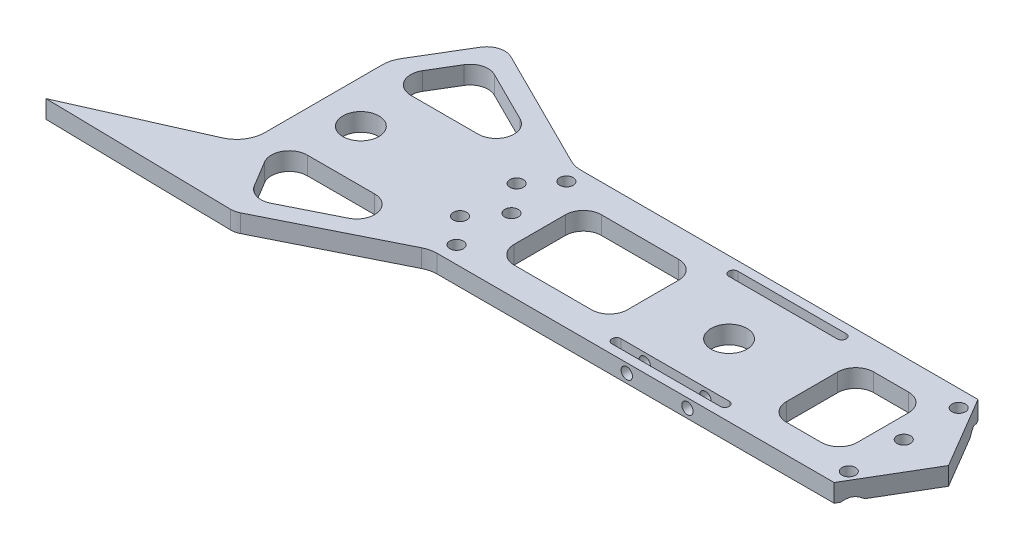
from build123d import *

# Parameters (mm, degrees)
CROQUIS1_R              = 6.35
SALIENTE_EXTRUIR1_DEPTH = 6.35
REDONDEO1_R             = 10
CORTAR_EXTRUIR2_DEPTH   = 225.405229946
CORTAR_EXTRUIR3_DEPTH   = 225.405229946
CROQUIS7_R              = 2.38125
CORTAR_EXTRUIR4_DEPTH   = 225.405229946
CROQUIS8_R              = 2.38125
CORTAR_EXTRUIR5_DEPTH   = 225.405229946
CROQUIS9_R              = 2
CORTAR_EXTRUIR6_DEPTH   = 15
CHAFL_N1_SIZE           = 2.5


with BuildPart() as part:
    # Croquis1 → Saliente-Extruir1 (new body)
    with BuildSketch(Plane(origin=(0, 0, 0), x_dir=(1, 0, 0), z_dir=(0, 1, 0))):
        with BuildLine():
            Line((37.5, -25.4), (52.5, 0))
            Line((52.5, 0), (37.5, 25.4))
            Line((37.5, 25.4), (-105, 25.4))
            Line((-105, 25.4), (-149.746813481, 47.731727951))
            ThreePointArc((-149.746813481, 47.731727951), (-154.357530471, 48.146831931), (-158.024774803, 45.321528145))
            Line((-158.024774803, 45.321528145), (-170, 25.4))
            Line((-170, 25.4), (-170, -25.4))
            Line((-170, -25.4), (-219.03156103, -47.147007635))
            Line((-219.03156103, -47.147007635), (-152.702210171, -48.398869348))
            ThreePointArc((-152.702210171, -48.398869348), (-151.184140049, -48.244143221), (-149.746813481, -47.731727951))
            Line((-149.746813481, -47.731727951), (-105, -25.4))
            Line((-105, -25.4), (37.5, -25.4))
        make_face()
        with Locations(Location((-155, 0, 0), (0, 0, 270))):
            Circle(CROQUIS1_R, mode=Mode.SUBTRACT)
        with Locations(Location((-25, 0, 0), (0, 0, 270))):
            Circle(CROQUIS1_R, mode=Mode.SUBTRACT)
        with BuildLine():
            Line((-129.045100716, 30.303281185), (-147.329198773, 39.428299747))
            ThreePointArc((-147.329198773, 39.428299747), (-151.939915763, 39.843403727), (-155.607160095, 37.018099941))
            Line((-155.607160095, 37.018099941), (-161.092389512, 27.893081378))
            ThreePointArc((-161.092389512, 27.893081378), (-161.177056347, 21.495189828), (-155.65, 18.271553233))
            Line((-155.65, 18.271553233), (-131.880672526, 18.271553233))
            ThreePointArc((-131.880672526, 18.271553233), (-125.699998109, 23.164925706), (-129.045100716, 30.303281185))
        make_face(mode=Mode.SUBTRACT)
        with BuildLine():
            Line((-129.045100716, -30.303281185), (-147.329198773, -39.428299747))
            ThreePointArc((-147.329198773, -39.428299747), (-151.939915763, -39.843403727), (-155.607160095, -37.018099941))
            Line((-155.607160095, -37.018099941), (-161.092389512, -27.893081378))
            ThreePointArc((-161.092389512, -27.893081378), (-161.177056347, -21.495189828), (-155.65, -18.271553233))
            Line((-155.65, -18.271553233), (-131.880672526, -18.271553233))
            ThreePointArc((-131.880672526, -18.271553233), (-125.699998109, -23.164925706), (-129.045100716, -30.303281185))
        make_face(mode=Mode.SUBTRACT)
    extrude(amount=SALIENTE_EXTRUIR1_DEPTH)

    # Redondeo1
    redondeo1_edges = [part.edges().sort_by_distance(p)[0] for p in [
        (-105, 3.175, 25.4),
        (-170, 3.175, 25.4),
        (-170, 3.175, -25.4),
        (-105, 3.175, -25.4),
    ]]
    fillet(redondeo1_edges, radius=REDONDEO1_R)

    # Croquis5 → Cortar-Extruir2 (cut, through all)
    with BuildSketch(Plane.XZ):
        with BuildLine():
            Line((-44.125, 22.225), (-5.875, 22.225))
            ThreePointArc((-5.875, 22.225), (-4.2875, 20.6375), (-5.875, 19.05))
            Line((-5.875, 19.05), (-44.125, 19.05))
            ThreePointArc((-44.125, 19.05), (-45.7125, 20.6375), (-44.125, 22.225))
        make_face()
        with BuildLine():
            Line((-5.875, -19.05), (-44.125, -19.05))
            ThreePointArc((-44.125, -19.05), (-45.7125, -20.6375), (-44.125, -22.225))
            Line((-44.125, -22.225), (-5.875, -22.225))
            ThreePointArc((-5.875, -22.225), (-4.2875, -20.6375), (-5.875, -19.05))
        make_face()
    extrude(amount=-CORTAR_EXTRUIR2_DEPTH, mode=Mode.SUBTRACT)

    # Croquis6 → Cortar-Extruir3 (cut, through all)
    with BuildSketch(Plane.XZ):
        with BuildLine():
            Line((-85.475, 15.4), (-58.175, 15.4))
            ThreePointArc((-58.175, 15.4), (-53.684871939, 13.540128061), (-51.825, 9.05))
            Line((-51.825, 9.05), (-51.825, -9.05))
            ThreePointArc((-51.825, -9.05), (-53.684871939, -13.540128061), (-58.175, -15.4))
            Line((-58.175, -15.4), (-85.475, -15.4))
            ThreePointArc((-85.475, -15.4), (-89.965128061, -13.540128061), (-91.825, -9.05))
            Line((-91.825, -9.05), (-91.825, 9.05))
            ThreePointArc((-91.825, 9.05), (-89.965128061, 13.540128061), (-85.475, 15.4))
        make_face()
        with BuildLine():
            Line((10.675, 15.4), (22.975, 15.4))
            ThreePointArc((22.975, 15.4), (27.465128061, 13.540128061), (29.325, 9.05))
            Line((29.325, 9.05), (29.325, -9.05))
            ThreePointArc((29.325, -9.05), (27.465128061, -13.540128061), (22.975, -15.4))
            Line((22.975, -15.4), (10.675, -15.4))
            ThreePointArc((10.675, -15.4), (6.184871939, -13.540128061), (4.325, -9.05))
            Line((4.325, -9.05), (4.325, 9.05))
            ThreePointArc((4.325, 9.05), (6.184871939, 13.540128061), (10.675, 15.4))
        make_face()
    extrude(amount=-CORTAR_EXTRUIR3_DEPTH, mode=Mode.SUBTRACT)

    # Croquis7 → Cortar-Extruir4 (cut, through all)
    with BuildSketch(Plane.XZ):
        with Locations(Location((-101.825, 0, 0), (0, 0, 270))):
            Circle(CROQUIS7_R)
        with Locations(Location((-101.825, 19.4, 0), (0, 0, 270))):
            Circle(CROQUIS7_R)
        with Locations(Location((-101.825, -19.4, 0), (0, 0, 270))):
            Circle(CROQUIS7_R)
        with Locations(Location((36.681745283, -19.4, 0), (0, 0, 90))):
            Circle(CROQUIS7_R)
        with Locations(Location((36.681745283, 19.4, 0), (0, 0, 90))):
            Circle(CROQUIS7_R)
        with Locations(Location((36.681745283, 0, 0), (0, 0, 90))):
            Circle(CROQUIS7_R)
    extrude(amount=-CORTAR_EXTRUIR4_DEPTH, mode=Mode.SUBTRACT)

    # Croquis8 → Cortar-Extruir5 (cut, through all)
    with BuildSketch(Plane.XZ):
        with Locations(Location((-110, -10, 0), (0, 0, 270))):
            Circle(CROQUIS8_R)
        with Locations(Location((-110, 10, 0), (0, 0, 270))):
            Circle(CROQUIS8_R)
    extrude(amount=-CORTAR_EXTRUIR5_DEPTH, mode=Mode.SUBTRACT)

    # Croquis9 → Cortar-Extruir6 (cut)
    with BuildSketch(Plane.XY.offset(25.4)):
        with Locations((-14.2875, 3.175)):
            Circle(CROQUIS9_R)
        with Locations((-35.7125, 3.175)):
            Circle(CROQUIS9_R)
    extrude(amount=-CORTAR_EXTRUIR6_DEPTH, mode=Mode.SUBTRACT)

    # Chaflán1
    # the kernel refuses this chamfer: 2.5 mm, written as the material it takes off along each edge
    with BuildSketch(Plane(origin=(-101.825, 0, 19.4), x_dir=(0, 0, -1), z_dir=(-1, 0, 0))) as chafl_n1_piece_1:
        Polygon((2.38125 + CHAFL_N1_SIZE, 0), (2.38125, -CHAFL_N1_SIZE), (2.38125, 0), align=None)
    revolve(axis=Axis((-101.825, 0, 19.4), (0, -1, 0)), mode=Mode.SUBTRACT)
    with BuildSketch(Plane(origin=(-101.825, 0, -19.4), x_dir=(0, 0, -1), z_dir=(-1, 0, 0))) as chafl_n1_piece_2:
        Polygon((2.38125 + CHAFL_N1_SIZE, 0), (2.38125, -CHAFL_N1_SIZE), (2.38125, 0), align=None)
    revolve(axis=Axis((-101.825, 0, -19.4), (0, -1, 0)), mode=Mode.SUBTRACT)
    with BuildSketch(Plane(origin=(36.681745283, 0, -19.4), x_dir=(0, 0, 1), z_dir=(1, 0, 0))) as chafl_n1_piece_3:
        Polygon((2.38125 + CHAFL_N1_SIZE, 0), (2.38125, -CHAFL_N1_SIZE), (2.38125, 0), align=None)
    revolve(axis=Axis((36.681745283, 0, -19.4), (0, -1, 0)), mode=Mode.SUBTRACT)
    with BuildSketch(Plane(origin=(36.681745283, 0, 19.4), x_dir=(0, 0, 1), z_dir=(1, 0, 0))) as chafl_n1_piece_4:
        Polygon((2.38125 + CHAFL_N1_SIZE, 0), (2.38125, -CHAFL_N1_SIZE), (2.38125, 0), align=None)
    revolve(axis=Axis((36.681745283, 0, 19.4), (0, -1, 0)), mode=Mode.SUBTRACT)
    with BuildSketch(Plane(origin=(36.681745283, 0, 0), x_dir=(0, 0, 1), z_dir=(1, 0, 0))) as chafl_n1_piece_5:
        Polygon((2.38125 + CHAFL_N1_SIZE, 0), (2.38125, -CHAFL_N1_SIZE), (2.38125, 0), align=None)
    revolve(axis=Axis((36.681745283, 0, 0), (0, -1, 0)), mode=Mode.SUBTRACT)
    with BuildSketch(Plane(origin=(-101.825, 0, 0), x_dir=(0, 0, -1), z_dir=(-1, 0, 0))) as chafl_n1_piece_6:
        Polygon((2.38125 + CHAFL_N1_SIZE, 0), (2.38125, -CHAFL_N1_SIZE), (2.38125, 0), align=None)
    revolve(axis=Axis((-101.825, 0, 0), (0, -1, 0)), mode=Mode.SUBTRACT)


solid = part.part
